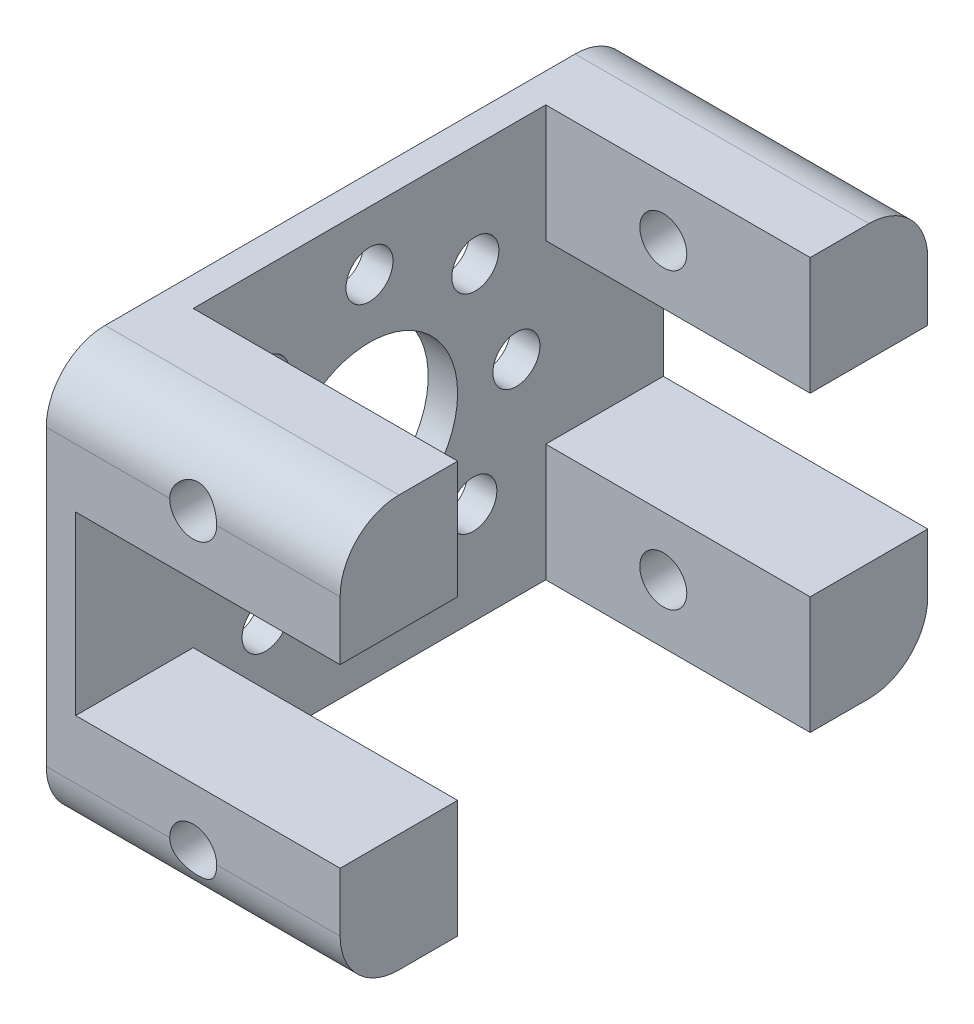
from build123d import *

# Parameters (mm, degrees)
ESBO_O1_W                = 100
ESBO_O1_H                = 70
RESSALTO_EXTRUS_O1_DEPTH = 50
ESBO_O3_W                = 45
ESBO_O3_H                = 30
CORTE_EXTRUS_O1_DEPTH    = 118.153745139
ESBO_O4_W                = 45
ESBO_O4_H                = 60
CORTE_EXTRUS_O2_DEPTH    = 100.498743711
ESBO_O5_R                = 15
CORTE_EXTRUS_O3_DEPTH    = 79.89866919
ESBO_O6_R                = 4
CORTE_EXTRUS_O4_DEPTH    = 79.89866919
ESBO_O6_3_R              = 4
CORTE_EXTRUS_O5_DEPTH    = 50
ESBO_O6_4_R              = 4
CORTE_EXTRUS_O6_DEPTH    = 50
ESBO_O6_5_R              = 4
CORTE_EXTRUS_O7_DEPTH    = 50
ESBO_O6_6_R              = 4
CORTE_EXTRUS_O8_DEPTH    = 50
ESBO_O6_7_R              = 4
CORTE_EXTRUS_O9_DEPTH    = 50
ESBO_O6_8_R              = 4
CORTE_EXTRUS_O10_DEPTH   = 50
ESBO_O8_R                = 4
CORTE_EXTRUS_O11_DEPTH   = 50
ESBO_O9_R                = 4
CORTE_EXTRUS_O12_DEPTH   = 118.153745139
ESBO_O10_R               = 4
CORTE_EXTRUS_O13_DEPTH   = 118.153745139
FILETE2_R                = 10
FILETE3_R                = 10
FILETE4_R                = 10
FILETE5_R                = 10


with BuildPart() as part:
    # Esboço1 → Ressalto-extrusão1 (new body)
    with BuildSketch(Plane(origin=(0, 0, 0), x_dir=(0, 0, -1), z_dir=(1, 0, 0))):
        Rectangle(ESBO_O1_W, ESBO_O1_H)
    extrude(amount=RESSALTO_EXTRUS_O1_DEPTH)

    # Esboço3 → Corte-extrusão1 (cut, through all)
    with BuildSketch(Plane.XY.offset(50)):
        with Locations((27.5, 0)):
            Rectangle(ESBO_O3_W, ESBO_O3_H)
    extrude(amount=-CORTE_EXTRUS_O1_DEPTH, mode=Mode.SUBTRACT)

    # Esboço4 → Corte-extrusão2 (cut, through all)
    with BuildSketch(Plane(origin=(0, -35, 0), x_dir=(-1, 0, 0), z_dir=(0, -1, 0))):
        with Locations((-27.5, 0)):
            Rectangle(ESBO_O4_W, ESBO_O4_H)
    extrude(amount=-CORTE_EXTRUS_O2_DEPTH, mode=Mode.SUBTRACT)

    # Esboço5 → Corte-extrusão3 (cut, through all)
    with BuildSketch(Plane.ZY):
        Circle(ESBO_O5_R)
    extrude(amount=-CORTE_EXTRUS_O3_DEPTH, mode=Mode.SUBTRACT)

    # Esboço6 → Corte-extrusão4 (cut, through all)
    with BuildSketch(Plane.ZY):
        with Locations((-25, 0)):
            Circle(ESBO_O6_R)
    extrude(amount=-CORTE_EXTRUS_O4_DEPTH, mode=Mode.SUBTRACT)

    # Esboço6<3> → Corte-extrusão5 (cut)
    with BuildSketch(Plane.ZY):
        with Locations((-17.67766953, -17.67766953)):
            Circle(ESBO_O6_3_R)
    extrude(amount=-CORTE_EXTRUS_O5_DEPTH, mode=Mode.SUBTRACT)

    # Esboço6<4> → Corte-extrusão6 (cut)
    with BuildSketch(Plane.ZY):
        with Locations((0, -25)):
            Circle(ESBO_O6_4_R)
    extrude(amount=-CORTE_EXTRUS_O6_DEPTH, mode=Mode.SUBTRACT)

    # Esboço6<5> → Corte-extrusão7 (cut)
    with BuildSketch(Plane.ZY):
        with Locations((17.67766953, -17.67766953)):
            Circle(ESBO_O6_5_R)
    extrude(amount=-CORTE_EXTRUS_O7_DEPTH, mode=Mode.SUBTRACT)

    # Esboço6<6> → Corte-extrusão8 (cut)
    with BuildSketch(Plane.ZY):
        with Locations((25, 0)):
            Circle(ESBO_O6_6_R)
    extrude(amount=-CORTE_EXTRUS_O8_DEPTH, mode=Mode.SUBTRACT)

    # Esboço6<7> → Corte-extrusão9 (cut)
    with BuildSketch(Plane.ZY):
        with Locations((17.67766953, 17.67766953)):
            Circle(ESBO_O6_7_R)
    extrude(amount=-CORTE_EXTRUS_O9_DEPTH, mode=Mode.SUBTRACT)

    # Esboço6<8> → Corte-extrusão10 (cut)
    with BuildSketch(Plane.ZY):
        with Locations((0, 25)):
            Circle(ESBO_O6_8_R)
    extrude(amount=-CORTE_EXTRUS_O10_DEPTH, mode=Mode.SUBTRACT)

    # Esboço8 → Corte-extrusão11 (cut)
    with BuildSketch(Plane.ZY):
        with Locations((-18.018451128, 17.56107414)):
            Circle(ESBO_O8_R)
    extrude(amount=-CORTE_EXTRUS_O11_DEPTH, mode=Mode.SUBTRACT)

    # Esboço9 → Corte-extrusão12 (cut, through all)
    with BuildSketch(Plane.XY.offset(50)):
        with Locations((25, -25)):
            Circle(ESBO_O9_R)
    extrude(amount=-CORTE_EXTRUS_O12_DEPTH, mode=Mode.SUBTRACT)

    # Esboço10 → Corte-extrusão13 (cut, through all)
    with BuildSketch(Plane.XY.offset(50)):
        with Locations((25, 25)):
            Circle(ESBO_O10_R)
    extrude(amount=-CORTE_EXTRUS_O13_DEPTH, mode=Mode.SUBTRACT)

    # Filete2
    # the kernel refuses this fillet: 10 mm, written as the material it takes off along each edge
    with BuildSketch(Plane(origin=(-25, -35, 50), x_dir=(0, 1, 0), z_dir=(1, 0, 0))) as filete2_piece_1:
        with BuildLine():
            CenterArc((FILETE2_R, -FILETE2_R), FILETE2_R, 90, 90)
            Line((0, -FILETE2_R), (0, 0))
            Line((0, 0), (FILETE2_R, 0))
        make_face()
    extrude(amount=100, mode=Mode.SUBTRACT)

    # Filete3
    # the kernel refuses this fillet: 10 mm, written as the material it takes off along each edge
    with BuildSketch(Plane(origin=(-25, 35, 50), x_dir=(0, 0, -1), z_dir=(1, 0, 0))) as filete3_piece_1:
        with BuildLine():
            CenterArc((FILETE3_R, -FILETE3_R), FILETE3_R, 90, 90)
            Line((0, -FILETE3_R), (0, 0))
            Line((0, 0), (FILETE3_R, 0))
        make_face()
    extrude(amount=100, mode=Mode.SUBTRACT)

    # Filete4
    # the kernel refuses this fillet: 10 mm, written as the material it takes off along each edge
    with BuildSketch(Plane(origin=(-25, 35, -50), x_dir=(0, 0, 1), z_dir=(1, 0, 0))) as filete4_piece_1:
        with BuildLine():
            CenterArc((FILETE4_R, FILETE4_R), FILETE4_R, 180, 90)
            Line((0, FILETE4_R), (0, 0))
            Line((0, 0), (FILETE4_R, 0))
        make_face()
    extrude(amount=100, mode=Mode.SUBTRACT)

    # Filete5
    # the kernel refuses this fillet: 10 mm, written as the material it takes off along each edge
    with BuildSketch(Plane(origin=(-25, -35, -50), x_dir=(0, 0, 1), z_dir=(1, 0, 0))) as filete5_piece_1:
        with BuildLine():
            CenterArc((FILETE5_R, -FILETE5_R), FILETE5_R, 90, 90)
            Line((0, -FILETE5_R), (0, 0))
            Line((0, 0), (FILETE5_R, 0))
        make_face()
    extrude(amount=100, mode=Mode.SUBTRACT)


solid = part.part
